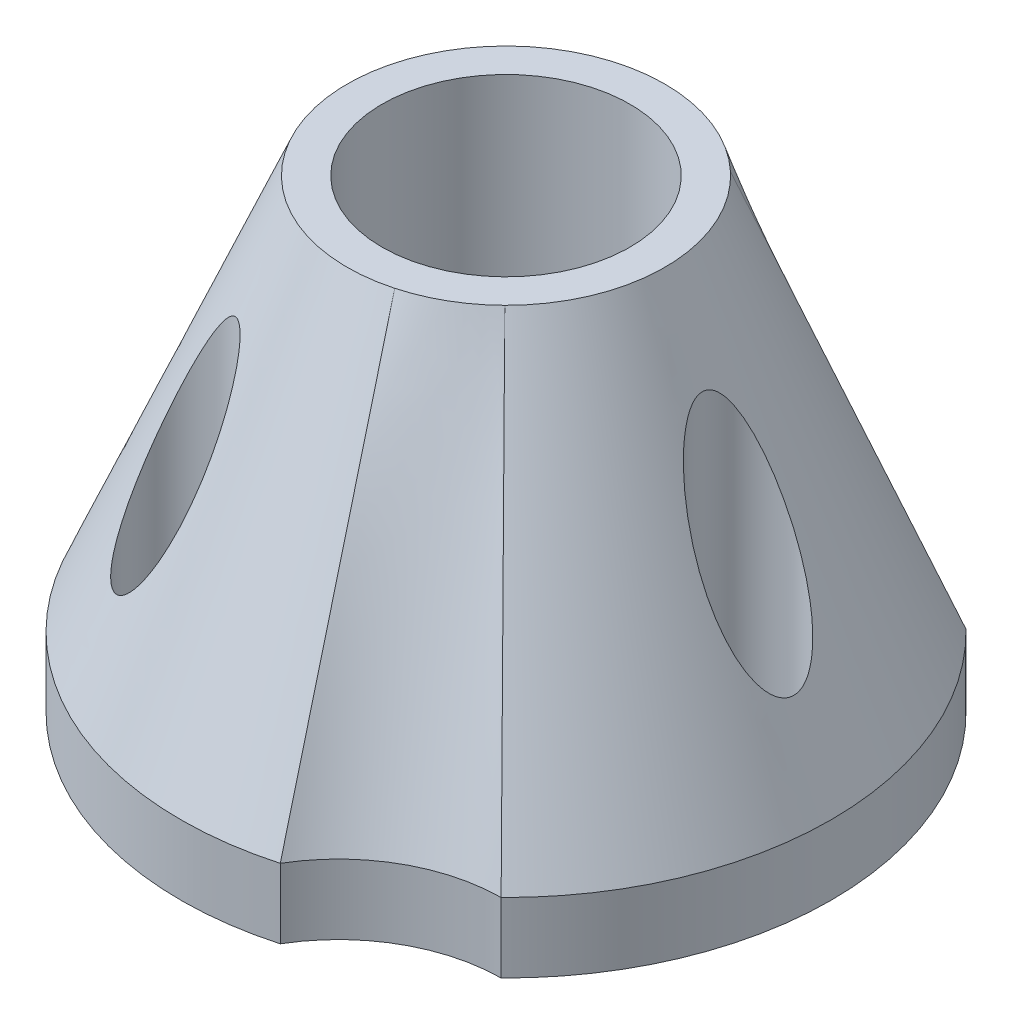
from build123d import *

# Parameters (mm, degrees)
SKETCH1_7_R         = 13.545312508
SKETCH1_7_R_2       = 2.749999961
BOSS_EXTRUDE5_DEPTH = 7.62
SKETCH22_R          = 13.545312508
CUT_EXTRUDE5_DEPTH  = 50.8
CUT_EXTRUDE6_START  = -7.62
SKETCH25_R          = 5.000000033
CUT_EXTRUDE6_DEPTH  = 50.8


with BuildPart() as part:
    # Loft1: read off the stored shape, not the designer's step
    # Loft1: loft between two sections, ruled curve by curve
    loft1_from = [
        Edge.make_bspline([(-13.254208322, 43.18, -11.204143609), (-12.633535537, 43.18, -11.93838325), (-11.234363216, 43.18, -13.344046012), (-8.723224564, 43.18, -15.10906815), (-5.939101227, 43.18, -16.401266946), (-4.022175406, 43.18, -16.91015434), (-1.710478922, 43.18, -17.326458565), (1.020054434, 43.18, -17.481351312), (4.980463095, 43.18, -16.784974288), (8.679744685, 43.18, -15.208556373), (10.883890774, 43.18, -13.589438037), (11.894269516, 43.18, -12.638561031)], [0, 0, 0, 0, 0.102328158, 0.204656316, 0.306984475, 0.409312633, 0.409312633, 0.556984475, 0.704656316, 0.852328158, 1, 1, 1, 1], 3),
        Edge.make_bspline([(11.894269516, 43.18, -12.638561031), (12.740278673, 43.18, -11.842373798), (14.270284892, 43.18, -10.078152976), (15.997402516, 43.18, -7.03109441), (17.074773024, 43.18, -3.698120252), (17.472737525, 43.18, -0.21776962), (17.161637133, 43.18, 3.271418367), (16.167668723, 43.18, 6.630208439), (14.517029172, 43.18, 9.719365325), (13.03146774, 43.18, 11.521170356), (12.205564683, 43.18, 12.338195291)], [0, 0, 0, 0, 0.125, 0.25, 0.375, 0.5, 0.625, 0.75, 0.875, 1, 1, 1, 1], 3),
        Edge.make_bspline([(-16.892449678, 43.18, 3.981459045), (-17.207801412, 43.18, 2.643491419), (-17.512085455, 43.18, -0.067776302), (-17.027841122, 43.18, -4.079613908), (-15.641514271, 43.18, -7.875326148), (-14.141633278, 43.18, -10.154343138), (-13.254208322, 43.18, -11.204143609)], [0, 0, 0, 0, 0.25, 0.5, 0.75, 1, 1, 1, 1], 3),
        Edge.make_bspline([(12.205564683, 43.18, 12.338195291), (10.085008735, 43.18, 14.43595612), (7.459400361, 43.18, 15.951851822), (4.582408217, 43.18, 16.739426728)], [0, 0, 0, 0, 1, 1, 1, 1], 3),
        Edge.make_bspline([(4.582408217, 43.18, 16.739426728), (3.46189234, 43.18, 17.04616729), (1.158702694, 43.18, 17.431798713), (-2.341905421, 43.18, 17.316716053), (-5.747687154, 43.18, 16.498122911), (-8.924962786, 43.18, 15.02294976), (-11.740052597, 43.18, 12.938127076), (-14.087807634, 43.18, 10.338609768), (-15.863078946, 43.18, 7.319352748), (-16.625935887, 43.18, 5.112218083), (-16.892449678, 43.18, 3.981459045)], [0, 0, 0, 0, 0.125, 0.25, 0.375, 0.5, 0.625, 0.75, 0.875, 1, 1, 1, 1], 3),
    ]
    loft1_to = [
        Edge.make_bspline([(-19.835889966, 0, -16.443230766), (-19.018147421, 0, -17.859602401), (-17.057565089, 0, -20.367755884), (-13.376669909, 0, -23.169071918), (-9.110211469, 0, -24.956162636), (-5.957795671, 0, -25.4), (-1.962108839, 0, -25.4), (2.861731958, 0, -25.4), (10.272303676, 0, -25.4), (17.682875393, 0, -25.4), (22.50671619, 0, -25.4), (24.866917932, 0, -25.4)], [0, 0, 0, 0, 0.102328158, 0.204656316, 0.306984475, 0.409312633, 0.409312633, 0.556984475, 0.704656316, 0.852328158, 1, 1, 1, 1], 3),
        Edge.make_bspline([(24.866917932, 0, -25.4), (26.551814028, 0, -23.750465632), (29.592317297, 0, -20.115125381), (32.984836959, 0, -13.867879688), (35.075453527, 0, -7.073333096), (35.781546505, 0, 0.000397722), (35.075296274, 0, 7.074112842), (32.98452866, 0, 13.868612957), (29.591870119, 0, 20.11578323), (26.551286035, 0, 23.751055888), (24.866353269, 0, 25.400552799)], [0, 0, 0, 0, 0.125, 0.25, 0.375, 0.5, 0.625, 0.75, 0.875, 1, 1, 1, 1], 3),
        Edge.make_bspline([(-34.430504222, 0, 8.835382643), (-33.214286367, 0, 6.728831526), (-30.781850658, 0, 2.515729291), (-27.133197094, 0, -3.803924062), (-23.48454353, 0, -10.123577414), (-21.05210782, 0, -14.336679649), (-19.835889966, 0, -16.443230766)], [0, 0, 0, 0, 0.25, 0.5, 0.75, 1, 1, 1, 1], 3),
        Edge.make_bspline([(24.866353269, 0, 25.400552799), (18.567965834, 0, 25.450034833), (12.756393776, 0, 28.805347525), (9.56434736, 0, 34.23517003)], [0, 0, 0, 0, 1, 1, 1, 1], 3),
        Edge.make_bspline([(9.56434736, 0, 34.23517003), (7.293374748, 0, 34.869616154), (2.624844235, 0, 35.685202884), (-4.481693194, 0, 35.49974623), (-11.411286707, 0, 33.91315404), (-17.890428815, 0, 30.987927121), (-23.663412914, 0, 26.839567256), (-28.502354586, 0, 21.631766902), (-32.216368229, 0, 15.570135845), (-33.844413603, 0, 11.119312649), (-34.430504222, 0, 8.835382643)], [0, 0, 0, 0, 0.125, 0.25, 0.375, 0.5, 0.625, 0.75, 0.875, 1, 1, 1, 1], 3),
    ]
    loft1 = Solid(Shell([*[Face.make_surface_from_curves(loft1_from[k], loft1_to[k]) for k in range(5)], Face(Wire(loft1_from)), Face(Wire(loft1_to))]))
    add(loft1)

    # Sketch1<7> → Boss-Extrude5 (add)
    with BuildSketch(Plane(origin=(0, 0, 0), x_dir=(1, 0, 0), z_dir=(0, 1, 0))):
        with BuildLine():
            Line((24.866917932, 25.4), (-4.322310581, 25.4))
            ThreePointArc((-4.322310581, 25.4), (-13.279079815, 23.000040917), (-19.835889966, 16.443230766))
            Line((-19.835889966, 16.443230766), (-34.430504222, -8.835382643))
            ThreePointArc((-34.430504222, -8.835382643), (-17.77269645, -30.784003449), (9.56434736, -34.23517003))
            ThreePointArc((9.56434736, -34.23517003), (16.05031386, -27.799959083), (24.866353269, -25.400552799))
            ThreePointArc((24.866353269, -25.400552799), (35.546077242, -0.000395105), (24.866917932, 25.4))
        make_face()
        with Locations(Location((0, 0, 0), (0, 0, 270))):
            Circle(SKETCH1_7_R, mode=Mode.SUBTRACT)
        with Locations(Location((26.450694876, 0, 0), (0, 0, 270))):
            Circle(SKETCH1_7_R_2, mode=Mode.SUBTRACT)
        with Locations(Location((-13.225347438, -22.90697371, 0), (0, 0, 270))):
            Circle(SKETCH1_7_R_2, mode=Mode.SUBTRACT)
    extrude(amount=-BOSS_EXTRUDE5_DEPTH)

    # Sketch22 → Cut-Extrude5 (cut)
    with BuildSketch(Plane(origin=(0, 43.18, 0), x_dir=(1, 0, 0), z_dir=(0, 1, 0))):
        with Locations(Location((0, 0, 0), (0, 0, 270))):
            Circle(SKETCH22_R)
    extrude(amount=-CUT_EXTRUDE5_DEPTH, mode=Mode.SUBTRACT)

    # Sketch25 → Cut-Extrude6 (cut)
    with BuildSketch(Plane.XZ.offset(7.62).offset(CUT_EXTRUDE6_START)):
        with Locations(Location((-13.225347438, 22.90697371, 0), (0, 0, 270))):
            Circle(SKETCH25_R)
        with Locations(Location((26.450694876, 0, 0), (0, 0, 270))):
            Circle(SKETCH25_R)
    extrude(amount=-CUT_EXTRUDE6_DEPTH, mode=Mode.SUBTRACT)


solid = part.part
